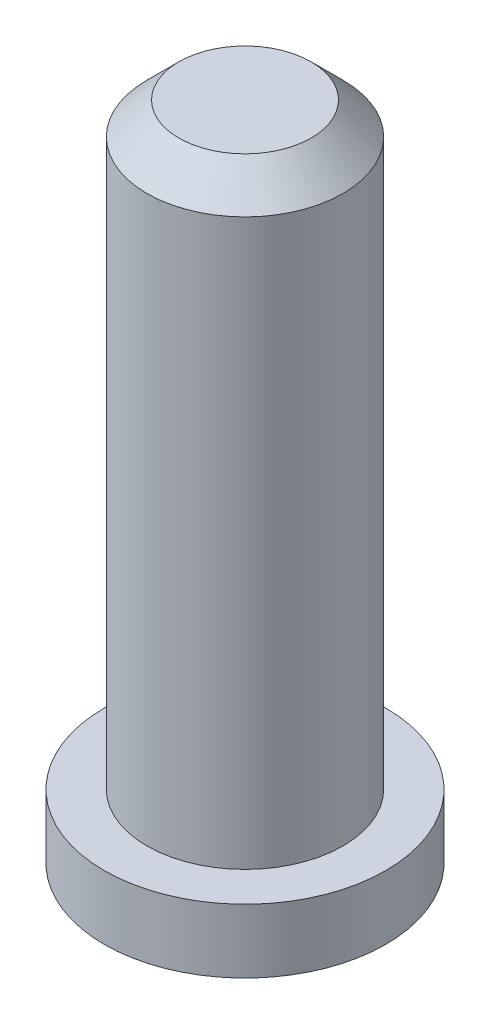
from build123d import *

# Parameters (mm, degrees)
CHAMFER1_SIZE = 0.75


with BuildPart() as part:
    # Sketch1 → Revolve1 (revolve)
    with BuildSketch(Plane.XY):
        Polygon((0, 15.5), (2.3, 15.5), (2.3, 1.5), (3.3, 1.5), (3.3, 0), (0, 0), align=None)
    revolve(axis=Axis((0, 0, 0), (0, 1, 0)))

    # Chamfer1
    chamfer1_edges = [part.edges().sort_by_distance(p)[0] for p in [
        (-2.3, 15.5, 0),
    ]]
    chamfer(chamfer1_edges, length=CHAMFER1_SIZE)


solid = part.part
